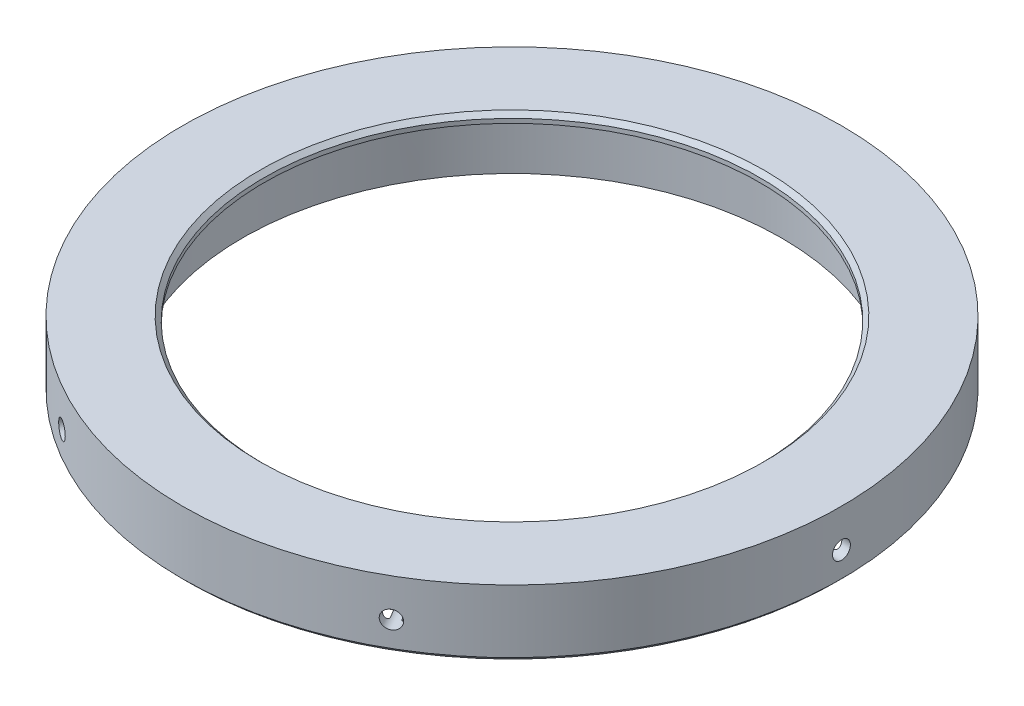
from build123d import *

# Parameters (mm, degrees)
SKIZZE1_R                       = 46.1
SKIZZE1_R_2                     = 37.7
AUFSATZ_LINEAR_AUSTRAGEN1_DEPTH = 1.2
AUFSATZ_LINEAR_START            = 8.2
SKIZZE2_R                       = 46.1
SKIZZE2_R_2                     = 44.9
SKIZZE2_R_3                     = 38.9
SKIZZE2_R_4                     = 37.7
AUFSATZ_LINEAR_AUSTRAGEN2_DEPTH = 8.2
AUFSATZ_LINEAR_START_2          = -1.2
SKIZZE3_R                       = 37.7
SKIZZE3_R_2                     = 34.7
AUFSATZ_LINEAR_AUSTRAGEN3_DEPTH = 1.2
AUFSATZ_LINEAR_START_3          = -8.2
AUFSATZ_LINEAR_AUSTRAGEN5_DEPTH = 8.2
FASE1_SIZE                      = 0.6
VERRUNDUNG1_R                   = 0.6
SCHNITT_LINEAR_START            = 50
SKIZZE8_R                       = 1.25
SCHNITT_LINEAR_AUSTRAGEN2_DEPTH = 9
KREISMUSTER2_COUNT              = 6


with BuildPart() as part:
    # Skizze1 → Aufsatz-Linear austragen1 (new body)
    with BuildSketch(Plane(origin=(0, 0, 0), x_dir=(1, 0, 0), z_dir=(0, 1, 0))):
        with Locations(Location((0, 0, 0), (0, 0, 270))):
            Circle(SKIZZE1_R)
        with Locations(Location((0, 0, 0), (0, 0, 270))):
            Circle(SKIZZE1_R_2, mode=Mode.SUBTRACT)
    extrude(amount=AUFSATZ_LINEAR_AUSTRAGEN1_DEPTH)

    # Skizze2 → Aufsatz-Linear austragen2 (add)
    # profile 1 of 2: a face of its own
    with BuildSketch(Plane.XZ.offset(AUFSATZ_LINEAR_START)):
        with Locations(Location((0, 0, 0), (0, 0, 270))):
            Circle(SKIZZE2_R)
        with Locations(Location((0, 0, 0), (0, 0, 270))):
            Circle(SKIZZE2_R_2, mode=Mode.SUBTRACT)
    # profile 2 of 2: a face of its own
    with BuildSketch(Plane.XZ.offset(AUFSATZ_LINEAR_START)):
        with Locations(Location((0, 0, 0), (0, 0, 90))):
            Circle(SKIZZE2_R_3)
        with Locations(Location((0, 0, 0), (0, 0, 270))):
            Circle(SKIZZE2_R_4, mode=Mode.SUBTRACT)
    extrude(amount=-AUFSATZ_LINEAR_AUSTRAGEN2_DEPTH)

    # Skizze3 → Aufsatz-Linear austragen3 (add)
    with BuildSketch(Plane(origin=(0, 1.2, 0), x_dir=(1, 0, 0), z_dir=(0, 1, 0)).offset(AUFSATZ_LINEAR_START_2)):
        with Locations(Location((0, 0, 0), (0, 0, 90))):
            Circle(SKIZZE3_R)
        with Locations(Location((0, 0, 0), (0, 0, 270))):
            Circle(SKIZZE3_R_2, mode=Mode.SUBTRACT)
    extrude(amount=AUFSATZ_LINEAR_AUSTRAGEN3_DEPTH)

    # Skizze5 → Aufsatz-Linear austragen5 (add)
    with BuildSketch(Plane(origin=(0, 0, 0), x_dir=(1, 0, 0), z_dir=(0, 1, 0)).offset(AUFSATZ_LINEAR_START_3)):
        with BuildLine():
            Line((0.6, 38.895372475), (0.6, 44.895990912))
            ThreePointArc((0.6, 44.895990912), (0, 44.9), (-0.6, 44.895990912))
            Line((-0.6, 44.895990912), (-0.6, 38.895372475))
            ThreePointArc((-0.6, 38.895372475), (0, 38.9), (0.6, 38.895372475))
        make_face()
        with BuildLine():
            Line((18.928070995, 33.984380653), (21.928380214, 39.181068658))
            ThreePointArc((21.928380214, 39.181068658), (22.45, 38.88454063), (22.967610698, 38.581068658))
            Line((22.967610698, 38.581068658), (19.96730148, 33.384380653))
            ThreePointArc((19.96730148, 33.384380653), (19.45, 33.688388207), (18.928070995, 33.984380653))
        make_face()
        with BuildLine():
            Line((33.384380653, 19.96730148), (38.581068658, 22.967610698))
            ThreePointArc((38.581068658, 22.967610698), (38.88454063, 22.45), (39.181068658, 21.928380214))
            Line((39.181068658, 21.928380214), (33.984380653, 18.928070995))
            ThreePointArc((33.984380653, 18.928070995), (33.688388207, 19.45), (33.384380653, 19.96730148))
        make_face()
        with BuildLine():
            Line((38.895372475, 0.6), (44.895990912, 0.6))
            ThreePointArc((44.895990912, 0.6), (44.9, 0), (44.895990912, -0.6))
            Line((44.895990912, -0.6), (38.895372475, -0.6))
            ThreePointArc((38.895372475, -0.6), (38.9, 0), (38.895372475, 0.6))
        make_face()
        with BuildLine():
            Line((33.984380653, -18.928070995), (39.181068658, -21.928380214))
            ThreePointArc((39.181068658, -21.928380214), (38.88454063, -22.45), (38.581068658, -22.967610698))
            Line((38.581068658, -22.967610698), (33.384380653, -19.96730148))
            ThreePointArc((33.384380653, -19.96730148), (33.688388207, -19.45), (33.984380653, -18.928070995))
        make_face()
        with BuildLine():
            Line((19.96730148, -33.384380653), (22.967610698, -38.581068658))
            ThreePointArc((22.967610698, -38.581068658), (22.45, -38.88454063), (21.928380214, -39.181068658))
            Line((21.928380214, -39.181068658), (18.928070995, -33.984380653))
            ThreePointArc((18.928070995, -33.984380653), (19.45, -33.688388207), (19.96730148, -33.384380653))
        make_face()
        with BuildLine():
            Line((0.6, -38.895372475), (0.6, -44.895990912))
            ThreePointArc((0.6, -44.895990912), (0, -44.9), (-0.6, -44.895990912))
            Line((-0.6, -44.895990912), (-0.6, -38.895372475))
            ThreePointArc((-0.6, -38.895372475), (0, -38.9), (0.6, -38.895372475))
        make_face()
        with BuildLine():
            Line((-18.928070995, -33.984380653), (-21.928380214, -39.181068658))
            ThreePointArc((-21.928380214, -39.181068658), (-22.45, -38.88454063), (-22.967610698, -38.581068658))
            Line((-22.967610698, -38.581068658), (-19.96730148, -33.384380653))
            ThreePointArc((-19.96730148, -33.384380653), (-19.45, -33.688388207), (-18.928070995, -33.984380653))
        make_face()
        with BuildLine():
            Line((-33.384380653, -19.96730148), (-38.581068658, -22.967610698))
            ThreePointArc((-38.581068658, -22.967610698), (-38.88454063, -22.45), (-39.181068658, -21.928380214))
            Line((-39.181068658, -21.928380214), (-33.984380653, -18.928070995))
            ThreePointArc((-33.984380653, -18.928070995), (-33.688388207, -19.45), (-33.384380653, -19.96730148))
        make_face()
        with BuildLine():
            Line((-38.895372475, -0.6), (-44.895990912, -0.6))
            ThreePointArc((-44.895990912, -0.6), (-44.9, 0), (-44.895990912, 0.6))
            Line((-44.895990912, 0.6), (-38.895372475, 0.6))
            ThreePointArc((-38.895372475, 0.6), (-38.9, 0), (-38.895372475, -0.6))
        make_face()
        with BuildLine():
            Line((-33.984380653, 18.928070995), (-39.181068658, 21.928380214))
            ThreePointArc((-39.181068658, 21.928380214), (-38.88454063, 22.45), (-38.581068658, 22.967610698))
            Line((-38.581068658, 22.967610698), (-33.384380653, 19.96730148))
            ThreePointArc((-33.384380653, 19.96730148), (-33.688388207, 19.45), (-33.984380653, 18.928070995))
        make_face()
        with BuildLine():
            Line((-19.96730148, 33.384380653), (-22.967610698, 38.581068658))
            ThreePointArc((-22.967610698, 38.581068658), (-22.45, 38.88454063), (-21.928380214, 39.181068658))
            Line((-21.928380214, 39.181068658), (-18.928070995, 33.984380653))
            ThreePointArc((-18.928070995, 33.984380653), (-19.45, 33.688388207), (-19.96730148, 33.384380653))
        make_face()
    extrude(amount=AUFSATZ_LINEAR_AUSTRAGEN5_DEPTH)

    # Fase1
    fase1_edges = [part.edges().sort_by_distance(p)[0] for p in [
        (0, -8.2, 46.1),
        (0, 1.2, -34.7),
    ]]
    chamfer(fase1_edges, length=FASE1_SIZE)

    # Verrundung1
    # the kernel refuses this fillet: 0.6 mm, written as the material it adds along each edge
    with BuildSketch(Plane(origin=(19.96730148, -8.2, 33.384380653), x_dir=(0.8543469481323831, 0, -0.5197030808229668), z_dir=(0, 1, 0)), Plane(origin=(0.6, -8.2, 38.895372475), x_dir=(0.9997377011398385, 0, -0.02290259635130979), z_dir=(0, 1, 0)), Plane(origin=(-18.928070995, -8.2, 33.984380653), x_dir=(0.8772495444837212, 0, 0.4800346203172266), z_dir=(0, 1, 0)), Plane(origin=(-33.384380653, -8.2, 19.96730148), x_dir=(0.5197030808224616, 0, 0.8543469481326904), z_dir=(0, 1, 0)), Plane(origin=(-38.895372475, -8.2, 0.6), x_dir=(0.02290259635090696, 0, 0.9997377011398476), z_dir=(0, 1, 0)), Plane(origin=(-33.984380653, -8.2, -18.928070995), x_dir=(-0.4800346203173753, 0, 0.8772495444836397), z_dir=(0, 1, 0)), Plane(origin=(-19.96730148, -8.2, -33.384380653), x_dir=(-0.8543469481326191, 0, 0.5197030808225785), z_dir=(0, 1, 0)), Plane(origin=(-0.6, -8.2, -38.895372475), x_dir=(-0.9997377011398391, 0, 0.02290259635128496), z_dir=(0, 1, 0)), Plane(origin=(18.928070995, -8.2, -33.984380653), x_dir=(-0.8772495444839002, 0, -0.4800346203168992), z_dir=(0, 1, 0)), Plane(origin=(33.384380653, -8.2, -19.96730148), x_dir=(-0.5197030808230644, 0, -0.8543469481323236), z_dir=(0, 1, 0)), Plane(origin=(38.895372475, -8.2, -0.6), x_dir=(-0.022902596351736998, 0, -0.9997377011398287), z_dir=(0, 1, 0)), Plane(origin=(33.984380653, -8.2, 18.928070995), x_dir=(0.48003462031673755, 0, -0.8772495444839886), z_dir=(0, 1, 0))) as verrundung1_piece_1:
        with BuildLine():
            CenterArc((0.586412642, -0.599983216), VERRUNDUNG1_R, 90.42856228, 88.259100866)
            Line((-0.013429979, -0.586241658), (-0.025426831, -0.585966827))
            Line((-0.025426831, -0.585966827), (-0.011996852, 0.000274831))
            Line((-0.011996852, 0.000274831), (8.9757e-05, 0.011999664))
            ThreePointArc((8.9757e-05, 0.011999664), (0.290962395, 0.010911821), (0.581835033, 0.011999664))
            Line((0.581835033, 0.011999664), (0.58192479, 0))
        make_face()
    extrude(amount=8.2)
    with BuildSketch(Plane(origin=(18.928070995, -8.2, 33.984380653), x_dir=(-0.8772495444839036, 0, 0.4800346203168932), z_dir=(0, 1, 0)), Plane(origin=(-0.6, -8.2, 38.895372475), x_dir=(-0.9997377011398387, 0, -0.02290259635129712), z_dir=(0, 1, 0)), Plane(origin=(-19.96730148, -8.2, 33.384380653), x_dir=(-0.8543469481326155, 0, -0.5197030808225849), z_dir=(0, 1, 0)), Plane(origin=(-33.984380653, -8.2, 18.928070995), x_dir=(-0.48003462031740096, 0, -0.8772495444836257), z_dir=(0, 1, 0)), Plane(origin=(-38.895372475, -8.2, -0.6), x_dir=(0.02290259635089437, 0, -0.9997377011398481), z_dir=(0, 1, 0)), Plane(origin=(-33.384380653, -8.2, -19.96730148), x_dir=(0.5197030808224802, 0, -0.8543469481326791), z_dir=(0, 1, 0)), Plane(origin=(-18.928070995, -8.2, -33.984380653), x_dir=(0.877249544483708, 0, -0.48003462031725047), z_dir=(0, 1, 0)), Plane(origin=(0.6, -8.2, -38.895372475), x_dir=(0.9997377011398385, 0, 0.02290259635130995), z_dir=(0, 1, 0)), Plane(origin=(19.96730148, -8.2, -33.384380653), x_dir=(0.8543469481324005, 0, 0.5197030808229381), z_dir=(0, 1, 0)), Plane(origin=(33.984380653, -8.2, -18.928070995), x_dir=(0.4800346203167581, 0, 0.8772495444839775), z_dir=(0, 1, 0)), Plane(origin=(38.895372475, -8.2, 0.6), x_dir=(-0.022902596351724386, 0, 0.999737701139829), z_dir=(0, 1, 0)), Plane(origin=(33.384380653, -8.2, 19.96730148), x_dir=(-0.5197030808230804, 0, 0.8543469481323139), z_dir=(0, 1, 0))) as verrundung1_piece_2:
        with BuildLine():
            CenterArc((0.586412642, 0.599983216), VERRUNDUNG1_R, 181.312336854, 88.259100866)
            Line((-0.013429979, 0.586241658), (-0.025426831, 0.585966827))
            Line((-0.025426831, 0.585966827), (-0.011996852, -0.000274831))
            Line((-0.011996852, -0.000274831), (8.9757e-05, -0.011999664))
            ThreePointArc((8.9757e-05, -0.011999664), (0.290962395, -0.010911821), (0.581835033, -0.011999664))
            Line((0.581835033, -0.011999664), (0.58192479, 0))
        make_face()
    extrude(amount=8.2)
    with BuildSketch(Plane(origin=(21.928380214, -8.2, 39.181068658), x_dir=(-0.8759612483728101, 0, 0.48238147906936496), z_dir=(0, 1, 0)), Plane(origin=(-0.6, -8.2, 44.895990912), x_dir=(-0.9997954333562663, 0, -0.020226008997223734), z_dir=(0, 1, 0)), Plane(origin=(-22.967610698, -8.2, 38.581068658), x_dir=(-0.8557352393755968, 0, -0.5174139542868844), z_dir=(0, 1, 0)), Plane(origin=(-39.181068658, -8.2, 21.928380214), x_dir=(-0.48238147906936496, 0, -0.8759612483728101), z_dir=(0, 1, 0)), Plane(origin=(-44.895990912, -8.2, -0.6), x_dir=(0.02022600899723525, 0, -0.999795433356266), z_dir=(0, 1, 0)), Plane(origin=(-38.581068658, -8.2, -22.967610698), x_dir=(0.517413954286898, 0, -0.8557352393755887), z_dir=(0, 1, 0)), Plane(origin=(-21.928380214, -8.2, -39.181068658), x_dir=(0.8759612483728163, 0, -0.4823814790693537), z_dir=(0, 1, 0)), Plane(origin=(0.6, -8.2, -44.895990912), x_dir=(0.9997954333562663, 0, 0.02022600899722388), z_dir=(0, 1, 0)), Plane(origin=(22.967610698, -8.2, -38.581068658), x_dir=(0.8557352393755936, 0, 0.5174139542868894), z_dir=(0, 1, 0)), Plane(origin=(39.181068658, -8.2, -21.928380214), x_dir=(0.4823814790693924, 0, 0.8759612483727949), z_dir=(0, 1, 0)), Plane(origin=(44.895990912, -8.2, 0.6), x_dir=(-0.02022600899722374, 0, 0.9997954333562663), z_dir=(0, 1, 0)), Plane(origin=(38.581068658, -8.2, 22.967610698), x_dir=(-0.5174139542868778, 0, 0.8557352393756009), z_dir=(0, 1, 0))) as verrundung1_piece_3:
        with BuildLine():
            CenterArc((0.612260568, -0.599985866), VERRUNDUNG1_R, 89.606723969, 91.552220011)
            Line((0.012383308, -0.612121471), (0.000385762, -0.612364183))
            Line((0.000385762, -0.612364183), (-0.011997545, -0.000242712))
            Line((-0.011997545, -0.000242712), (-8.2367e-05, 0.011999717))
            ThreePointArc((-8.2367e-05, 0.011999717), (0.308189456, 0.013057704), (0.616461279, 0.011999717))
            Line((0.616461279, 0.011999717), (0.616378912, 0))
        make_face()
    extrude(amount=8.2)
    with BuildSketch(Plane(origin=(22.967610698, -8.2, 38.581068658), x_dir=(0.8557352393755804, 0, -0.5174139542869115), z_dir=(0, 1, 0)), Plane(origin=(0.6, -8.2, 44.895990912), x_dir=(0.9997954333562663, 0, -0.020226008997223793), z_dir=(0, 1, 0)), Plane(origin=(-21.928380214, -8.2, 39.181068658), x_dir=(0.8759612483728039, 0, 0.48238147906937623), z_dir=(0, 1, 0)), Plane(origin=(-38.581068658, -8.2, 22.967610698), x_dir=(0.5174139542869123, 0, 0.8557352393755799), z_dir=(0, 1, 0)), Plane(origin=(-44.895990912, -8.2, 0.6), x_dir=(0.020226008997234656, 0, 0.999795433356266), z_dir=(0, 1, 0)), Plane(origin=(-39.181068658, -8.2, -21.928380214), x_dir=(-0.4823814790693592, 0, 0.8759612483728133), z_dir=(0, 1, 0)), Plane(origin=(-22.967610698, -8.2, -38.581068658), x_dir=(-0.8557352393755763, 0, 0.517413954286918), z_dir=(0, 1, 0)), Plane(origin=(-0.6, -8.2, -44.895990912), x_dir=(-0.9997954333562665, 0, 0.02022600899721256), z_dir=(0, 1, 0)), Plane(origin=(21.928380214, -8.2, -39.181068658), x_dir=(-0.8759612483728101, 0, -0.48238147906936496), z_dir=(0, 1, 0)), Plane(origin=(38.581068658, -8.2, -22.967610698), x_dir=(-0.5174139542869005, 0, -0.855735239375587), z_dir=(0, 1, 0)), Plane(origin=(44.895990912, -8.2, -0.6), x_dir=(-0.020226008997223786, 0, -0.9997954333562663), z_dir=(0, 1, 0)), Plane(origin=(39.181068658, -8.2, 21.928380214), x_dir=(0.48238147906936013, 0, -0.8759612483728128), z_dir=(0, 1, 0))) as verrundung1_piece_4:
        with BuildLine():
            CenterArc((0.612260568, 0.599985866), VERRUNDUNG1_R, 178.84105602, 91.552220011)
            Line((0.012383308, 0.612121471), (0.000385762, 0.612364183))
            Line((0.000385762, 0.612364183), (-0.011997545, 0.000242712))
            Line((-0.011997545, 0.000242712), (-8.2367e-05, -0.011999717))
            ThreePointArc((-8.2367e-05, -0.011999717), (0.308189456, -0.013057704), (0.616461279, -0.011999717))
            Line((0.616461279, -0.011999717), (0.616378912, 0))
        make_face()
    extrude(amount=8.2)

    # Skizze8 → Schnitt-Linear austragen2 (cut)
    with BuildSketch(Plane(origin=(0, 0, 0), x_dir=(0, 0, -1), z_dir=(1, 0, 0)).offset(SCHNITT_LINEAR_START)):
        with Locations((0, -4.1)):
            Circle(SKIZZE8_R)
    schnitt_linear_austragen2 = extrude(amount=-SCHNITT_LINEAR_AUSTRAGEN2_DEPTH, mode=Mode.SUBTRACT)

    # Kreismuster2: Schnitt-Linear austragen2 ×6 about axis
    kreismuster2_axis = Axis((0, 0, 0), (0, 1, 0))
    for i in range(1, KREISMUSTER2_COUNT):
        add(schnitt_linear_austragen2.rotate(kreismuster2_axis, i * 360 / KREISMUSTER2_COUNT), mode=Mode.SUBTRACT)


solid = part.part
